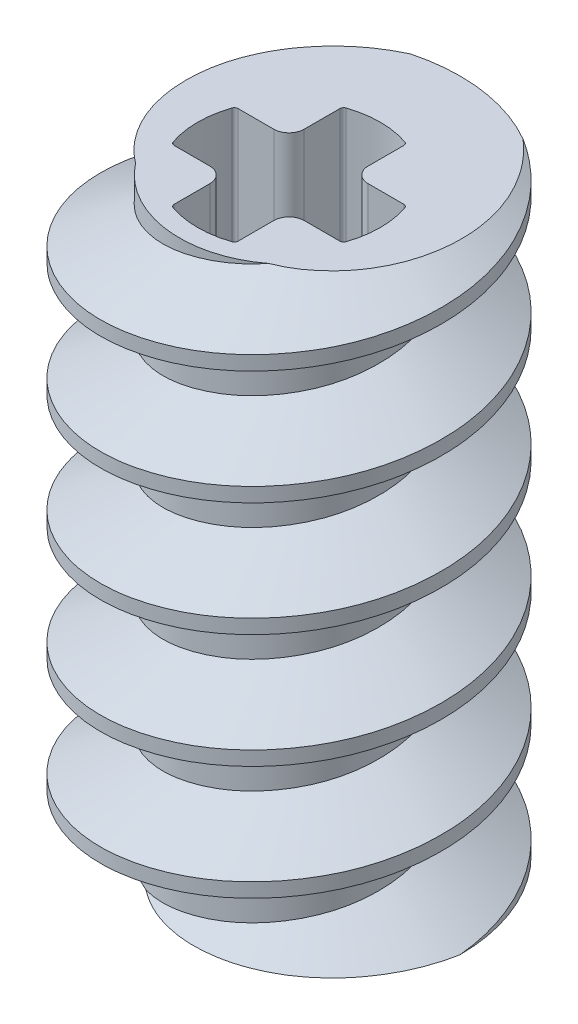
from build123d import *

# Parameters (mm, degrees)
SKETCH1_R           = 4.5
BOSS_EXTRUDE1_DEPTH = 7.75
THREAD2_PITCH       = 3
CUT_EXTRUDE1_DEPTH  = 17.755596226


with BuildPart() as part:
    # Sketch1 → Boss-Extrude1 (new, symmetric)
    with BuildSketch(Plane(origin=(0, 0, 0), x_dir=(1, 0, 0), z_dir=(0, 1, 0))):
        with Locations(Location((0, 0, 0), (0, 0, 270))):
            Circle(SKETCH1_R)
    extrude(amount=BOSS_EXTRUDE1_DEPTH, both=True)

    # Thread2: the profile of Thread Profile2 profile screwed along a right-hand helix of 7.166667 turns, 10 arcs to a turn; built about Z, then put on its axis
    thread2_z = Axis((0, 0, 0), (0, 0, 1))
    thread2_corners = [(4.5003, 0, -0.000173205), (4.5003, 0, 2.625173197), (2.876202375, 0, 1.687499996), (2.876202375, 0, 0.937499996)]
    with BuildLine(mode=Mode.PRIVATE) as thread2_profile:
        Line(thread2_corners[0], thread2_corners[1])
        Line(thread2_corners[1], thread2_corners[2])
        Line(thread2_corners[2], thread2_corners[3])
        Line(thread2_corners[3], thread2_corners[0])
    thread2_cap = Face(thread2_profile.wire())
    thread2_turn_angles = [0, 18, 36, 54, 72, 90, 108, 126, 144, 162, 180, 198, 216, 234, 252, 270, 288, 306, 324, 342, 360]
    thread2_turn_weights = [1, 0.9510565162951535, 1, 0.9510565162951535, 1, 0.9510565162951535, 1, 0.9510565162951535, 1, 0.9510565162951535, 1, 0.9510565162951535, 1, 0.9510565162951535, 1, 0.9510565162951535, 1, 0.9510565162951535, 1, 0.9510565162951535, 1]
    thread2_turn_rails = [Edge.make_bspline([Vector(p[0], p[1], 0).rotate(thread2_z, thread2_turn_angles[k]) / thread2_turn_weights[k] + Vector(0, 0, p[2] + THREAD2_PITCH * thread2_turn_angles[k] / 360) for k in range(21)], [0, 0, 0, 1, 1, 2, 2, 3, 3, 4, 4, 5, 5, 6, 6, 7, 7, 8, 8, 9, 9, 10, 10, 10], 2, thread2_turn_weights) for p in thread2_corners]
    thread2_turn_sides = [Face.make_surface_from_curves(thread2_turn_rails[p[0]], thread2_turn_rails[p[1]]) for p in [(0, 1), (1, 2), (2, 3), (3, 0)]]
    thread2_last_angles = [2520, 2538, 2556, 2568, 2580]
    thread2_last_weights = [1, 0.9510565162951535, 1, 0.9781476007338072, 1]
    thread2_last_rails = [Edge.make_bspline([Vector(p[0], p[1], 0).rotate(thread2_z, thread2_last_angles[k]) / thread2_last_weights[k] + Vector(0, 0, p[2] + THREAD2_PITCH * thread2_last_angles[k] / 360) for k in range(5)], [0, 0, 0, 1, 1, 2, 2, 2], 2, thread2_last_weights) for p in thread2_corners]
    thread2_last_sides = [Face.make_surface_from_curves(thread2_last_rails[p[0]], thread2_last_rails[p[1]]) for p in [(0, 1), (1, 2), (2, 3), (3, 0)]]
    thread2 = Plane(origin=(0, -13.75, 0), x_dir=(1, 0, 0), z_dir=(0, 1, 0)) * Solid(Shell([*[p.moved(Location((0, 0, THREAD2_PITCH * i))) for i in range(7) for p in thread2_turn_sides], *thread2_last_sides, thread2_cap, thread2_cap.rotate(thread2_z, 2580).moved(Location((0, 0, THREAD2_PITCH * 2580 / 360)))]))
    add(thread2, mode=Mode.SUBTRACT)

    # Sketch2 → Cut-Extrude1 (cut, through all)
    with BuildSketch(Plane(origin=(0, 7.75, 0), x_dir=(1, 0, 0), z_dir=(0, 1, 0))):
        with BuildLine():
            Line((-0.84, 1.24), (-0.84, 2.177705214))
            ThreePointArc((-0.84, 2.177705214), (-0.821293884, 2.235940121), (-0.772173913, 2.27238805))
            ThreePointArc((-0.772173913, 2.27238805), (0, 2.4), (0.772173913, 2.27238805))
            ThreePointArc((0.772173913, 2.27238805), (0.821293884, 2.235940121), (0.84, 2.177705214))
            Line((0.84, 2.177705214), (0.84, 1.24))
            ThreePointArc((0.84, 1.24), (0.957157288, 0.957157288), (1.24, 0.84))
            Line((1.24, 0.84), (2.177705214, 0.84))
            ThreePointArc((2.177705214, 0.84), (2.235940121, 0.821293884), (2.27238805, 0.772173913))
            ThreePointArc((2.27238805, 0.772173913), (2.4, 0), (2.27238805, -0.772173913))
            ThreePointArc((2.27238805, -0.772173913), (2.235940121, -0.821293884), (2.177705214, -0.84))
            Line((2.177705214, -0.84), (1.24, -0.84))
            ThreePointArc((1.24, -0.84), (0.957157288, -0.957157288), (0.84, -1.24))
            Line((0.84, -1.24), (0.84, -2.177705214))
            ThreePointArc((0.84, -2.177705214), (0.821293884, -2.235940121), (0.772173913, -2.27238805))
            ThreePointArc((0.772173913, -2.27238805), (0, -2.4), (-0.772173913, -2.27238805))
            ThreePointArc((-0.772173913, -2.27238805), (-0.821293884, -2.235940121), (-0.84, -2.177705214))
            Line((-0.84, -2.177705214), (-0.84, -1.24))
            ThreePointArc((-0.84, -1.24), (-0.957157288, -0.957157288), (-1.24, -0.84))
            Line((-1.24, -0.84), (-2.177705214, -0.84))
            ThreePointArc((-2.177705214, -0.84), (-2.235940121, -0.821293884), (-2.27238805, -0.772173913))
            ThreePointArc((-2.27238805, -0.772173913), (-2.4, 0), (-2.27238805, 0.772173913))
            ThreePointArc((-2.27238805, 0.772173913), (-2.235940121, 0.821293884), (-2.177705214, 0.84))
            Line((-2.177705214, 0.84), (-1.24, 0.84))
            ThreePointArc((-1.24, 0.84), (-0.957157288, 0.957157288), (-0.84, 1.24))
        make_face()
    extrude(amount=-CUT_EXTRUDE1_DEPTH, mode=Mode.SUBTRACT)


solid = part.part
